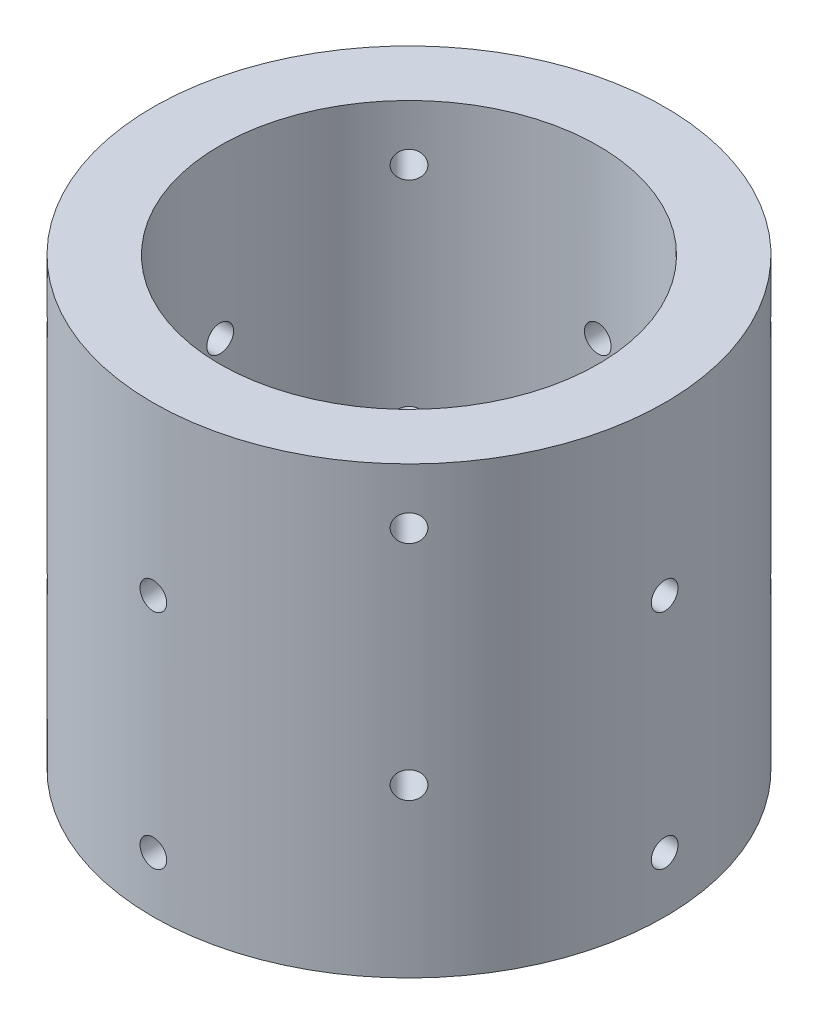
from build123d import *

# Parameters (mm, degrees)
SKETCH_1_R               = 23
EXTRUDE_1_DEPTH          = 10
SKETCH_2_R               = 23
SKETCH_2_R_2             = 17
EXTRUDE_2_DEPTH          = 30
CUT_EXTRUDE_START        = -16.8
SKETCH_3_R               = 1.2
CUT_EXTRUDE_1_DEPTH      = 35.755795019
SKETCH_4_R               = 1.2
CUT_EXTRUDE_2_DEPTH      = 52.555795185
PATTERN_CIRCULAR_1_COUNT = 4
PATTERN_CIRCULAR_2_COUNT = 4


with BuildPart() as part:
    # Эскиз1 → Бобышка-Вытянуть1 (new body)
    with BuildSketch(Plane(origin=(0, 0, 0), x_dir=(1, 0, 0), z_dir=(0, 1, 0))):
        Circle(SKETCH_1_R)
    extrude(amount=EXTRUDE_1_DEPTH)

    # Эскиз2 → Бобышка-Вытянуть2 (add)
    with BuildSketch(Plane(origin=(0, 10, 0), x_dir=(1, 0, 0), z_dir=(0, 1, 0))):
        Circle(SKETCH_2_R)
        Circle(SKETCH_2_R_2, mode=Mode.SUBTRACT)
    extrude(amount=EXTRUDE_2_DEPTH)

    # Эскиз3 → Вырез-Вытянуть1 (cut, through all)
    with BuildSketch(Plane(origin=(0, 0, 0), x_dir=(0, 0, -1), z_dir=(1, 0, 0)).offset(CUT_EXTRUDE_START)):
        with Locations((0, 25)):
            Circle(SKETCH_3_R)
        with Locations((0, 5)):
            Circle(SKETCH_3_R)
    cut_extrude_1 = extrude(amount=-CUT_EXTRUDE_1_DEPTH, mode=Mode.SUBTRACT)

    # Эскиз4 → Вырез-Вытянуть2 (cut, through all)
    with BuildSketch(Plane(origin=(0, 0, 0), x_dir=(0, -1, 0), z_dir=(0.7071067811865464, 0, 0.7071067811865488))):
        with Locations((-15, 0)):
            Circle(SKETCH_4_R)
        with Locations((-35, 0)):
            Circle(SKETCH_4_R)
    cut_extrude_2 = extrude(amount=-CUT_EXTRUDE_2_DEPTH, mode=Mode.SUBTRACT)

    # Круговой массив1: Вырез-Вытянуть1 ×4 about axis
    pattern_circular_1_axis = Axis((0, 10, 0), (0, -1, 0))
    for i in range(1, PATTERN_CIRCULAR_1_COUNT):
        add(cut_extrude_1.rotate(pattern_circular_1_axis, i * 360 / PATTERN_CIRCULAR_1_COUNT), mode=Mode.SUBTRACT)

    # Круговой массив2: Вырез-Вытянуть2 ×4 about axis
    pattern_circular_2_axis = Axis((0, 10, 0), (0, -1, 0))
    for i in range(1, PATTERN_CIRCULAR_2_COUNT):
        add(cut_extrude_2.rotate(pattern_circular_2_axis, i * 360 / PATTERN_CIRCULAR_2_COUNT), mode=Mode.SUBTRACT)


solid = part.part
